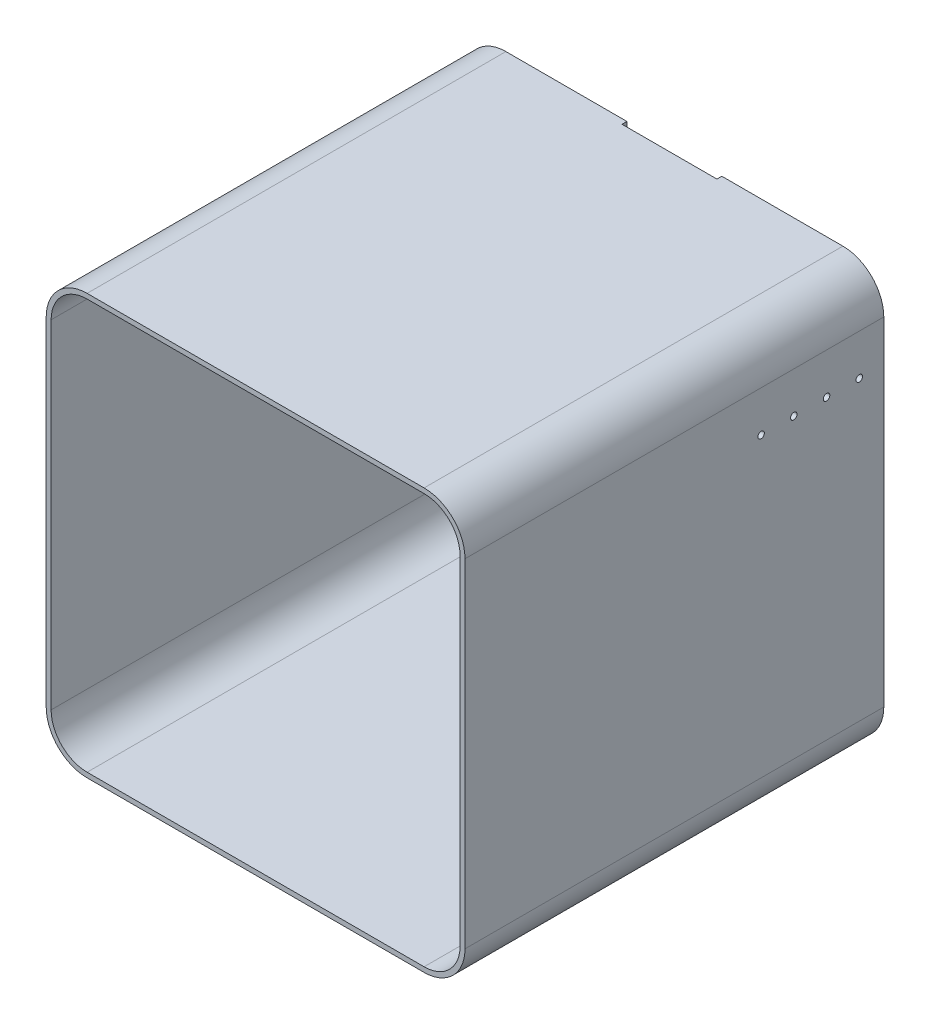
from build123d import *

# Parameters (mm, degrees)
EXTRUDE_THIN1_DEPTH = 512
SKETCH3_R           = 4
CUT_EXTRUDE1_DEPTH  = 10
LPATTERN1_COUNT     = 4
LPATTERN1_PITCH     = 40
SKETCH4_W           = 116
SKETCH4_H           = 6
CUT_EXTRUDE2_DEPTH  = 6


with BuildPart() as part:
    # Sketch1 → Extrude-Thin1 (new body)
    with BuildSketch(Plane.XY):
        with BuildLine():
            Line((44, -6), (456, -6))
            ThreePointArc((456, -6), (491.355339059, 8.644660941), (506, 44))
            Line((506, 44), (506, 457))
            ThreePointArc((506, 457), (491.355339059, 492.355339059), (456, 507))
            Line((456, 507), (44, 507))
            ThreePointArc((44, 507), (8.644660941, 492.355339059), (-6, 457))
            Line((-6, 457), (-6, 44))
            ThreePointArc((-6, 44), (8.644660941, 8.644660941), (44, -6))
        make_face()
        with BuildLine():
            Line((44, 0), (456, 0))
            ThreePointArc((456, 0), (487.112698372, 12.887301628), (500, 44))
            Line((500, 44), (500, 457))
            ThreePointArc((500, 457), (487.112698372, 488.112698372), (456, 501))
            Line((456, 501), (44, 501))
            ThreePointArc((44, 501), (12.887301628, 488.112698372), (0, 457))
            Line((0, 457), (0, 44))
            ThreePointArc((0, 44), (12.887301628, 12.887301628), (44, 0))
        make_face(mode=Mode.SUBTRACT)
    extrude(amount=-EXTRUDE_THIN1_DEPTH)

    # Sketch3 → Cut-Extrude1 (cut)
    with BuildSketch(Plane(origin=(506, 0, 0), x_dir=(0, 0, -1), z_dir=(1, 0, 0))):
        with Locations((482, 407)):
            Circle(SKETCH3_R)
    cut_extrude1 = extrude(amount=-CUT_EXTRUDE1_DEPTH, mode=Mode.SUBTRACT)

    # LPattern1: Cut-Extrude1 ×4
    with Locations(*[(0, 0, i * LPATTERN1_PITCH) for i in range(1, LPATTERN1_COUNT)]):
        add(cut_extrude1, mode=Mode.SUBTRACT)

    # Sketch4 → Cut-Extrude2 (cut)
    with BuildSketch(Plane(origin=(0, 0, -512), x_dir=(-1, 0, 0), z_dir=(0, 0, -1))):
        with Locations((-250, 504)):
            Rectangle(SKETCH4_W, SKETCH4_H)
    extrude(amount=-CUT_EXTRUDE2_DEPTH, mode=Mode.SUBTRACT)


solid = part.part
